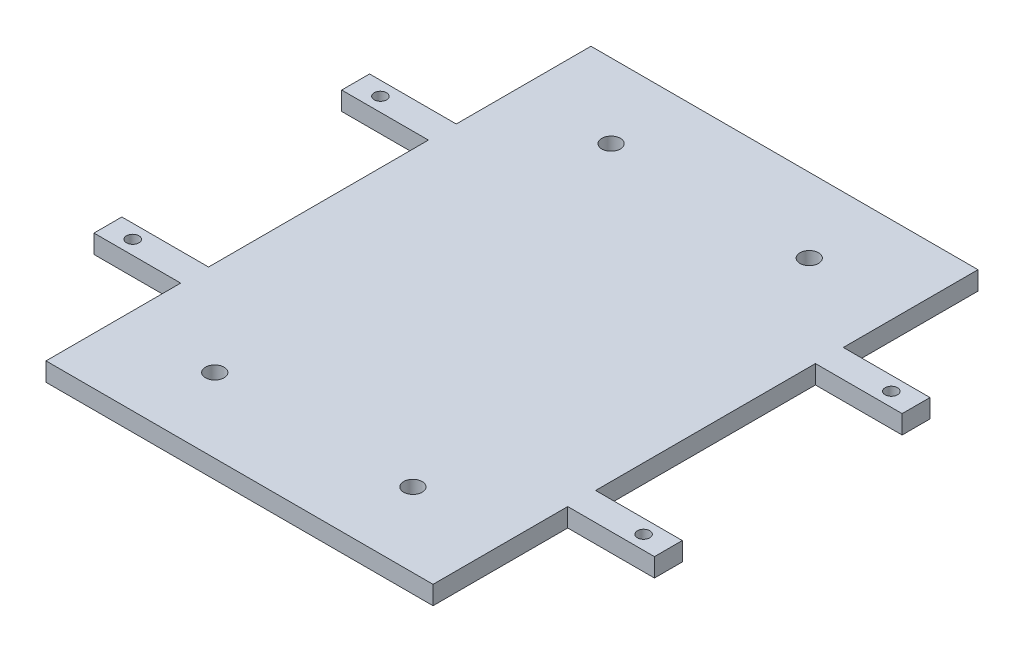
from build123d import *

# Parameters (mm, degrees)
BOSS_EXTRUDE1_DEPTH = 3
SKETCH2_R           = 1
CUT_EXTRUDE1_DEPTH  = 6
SKETCH3_R           = 1.5
CUT_EXTRUDE2_DEPTH  = 10


with BuildPart() as part:
    # Sketch1 → Boss-Extrude1 (new body)
    with BuildSketch(Plane(origin=(0, 0, 0), x_dir=(1, 0, 0), z_dir=(0, 1, 0))):
        Polygon((-45.25, 22.25), (-31.25, 22.25), (-31.25, 44), (31.25, 44), (31.25, 22.25), (45.25, 22.25), (45.25, 17.75), (31.25, 17.75), (31.25, -17.75), (45.25, -17.75), (45.25, -22.25), (31.25, -22.25), (31.25, -44), (-31.25, -44), (-31.25, -22.25), (-45.25, -22.25), (-45.25, -17.75), (-31.25, -17.75), (-31.25, 17.75), (-45.25, 17.75), align=None)
    extrude(amount=BOSS_EXTRUDE1_DEPTH)

    # Sketch2 → Cut-Extrude1 (cut)
    with BuildSketch(Plane.XZ):
        with Locations((-41.25, 20)):
            Circle(SKETCH2_R)
        with Locations((-41.25, -20)):
            Circle(SKETCH2_R)
        with Locations((41.25, -20)):
            Circle(SKETCH2_R)
        with Locations((41.25, 20)):
            Circle(SKETCH2_R)
    extrude(amount=-CUT_EXTRUDE1_DEPTH, mode=Mode.SUBTRACT)

    # Sketch3 → Cut-Extrude2 (cut)
    with BuildSketch(Plane(origin=(0, 3, 0), x_dir=(1, 0, 0), z_dir=(0, 1, 0))):
        with Locations((-16, 32)):
            Circle(SKETCH3_R)
        with Locations((16, 32)):
            Circle(SKETCH3_R)
        with Locations((16, -32)):
            Circle(SKETCH3_R)
        with Locations((-16, -32)):
            Circle(SKETCH3_R)
    extrude(amount=-CUT_EXTRUDE2_DEPTH, mode=Mode.SUBTRACT)


solid = part.part
